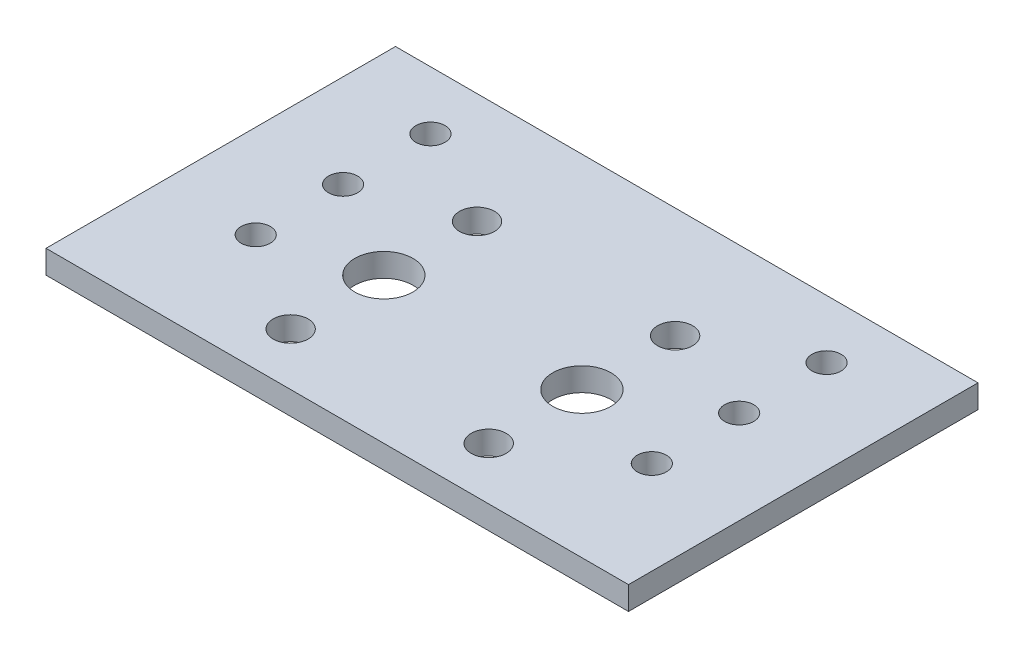
from build123d import *

# Parameters (mm, degrees)
SKETCH_1_W      = 100
SKETCH_1_H      = 60
SKETCH_1_R      = 2.5
SKETCH_1_R_2    = 5
SKETCH_1_R_3    = 3
EXTRUDE_1_DEPTH = 4


with BuildPart() as part:
    # Эскиз1 → Бобышка-Вытянуть1 (new body)
    with BuildSketch(Plane(origin=(0, 0, 0), x_dir=(1, 0, 0), z_dir=(0, 1, 0))):
        with Locations((50, 30)):
            Rectangle(SKETCH_1_W, SKETCH_1_H)
        with Locations((16, 50)):
            Circle(SKETCH_1_R, mode=Mode.SUBTRACT)
        with Locations((16, 35)):
            Circle(SKETCH_1_R, mode=Mode.SUBTRACT)
        with Locations((16, 20)):
            Circle(SKETCH_1_R, mode=Mode.SUBTRACT)
        with Locations((84, 50)):
            Circle(SKETCH_1_R, mode=Mode.SUBTRACT)
        with Locations((84, 35)):
            Circle(SKETCH_1_R, mode=Mode.SUBTRACT)
        with Locations((84, 20)):
            Circle(SKETCH_1_R, mode=Mode.SUBTRACT)
        with Locations((33, 25)):
            Circle(SKETCH_1_R_2, mode=Mode.SUBTRACT)
        with Locations((67, 25)):
            Circle(SKETCH_1_R_2, mode=Mode.SUBTRACT)
        with Locations((33, 41)):
            Circle(SKETCH_1_R_3, mode=Mode.SUBTRACT)
        with Locations((33, 9)):
            Circle(SKETCH_1_R_3, mode=Mode.SUBTRACT)
        with Locations((67, 41)):
            Circle(SKETCH_1_R_3, mode=Mode.SUBTRACT)
        with Locations((67, 9)):
            Circle(SKETCH_1_R_3, mode=Mode.SUBTRACT)
    extrude(amount=EXTRUDE_1_DEPTH)


solid = part.part
